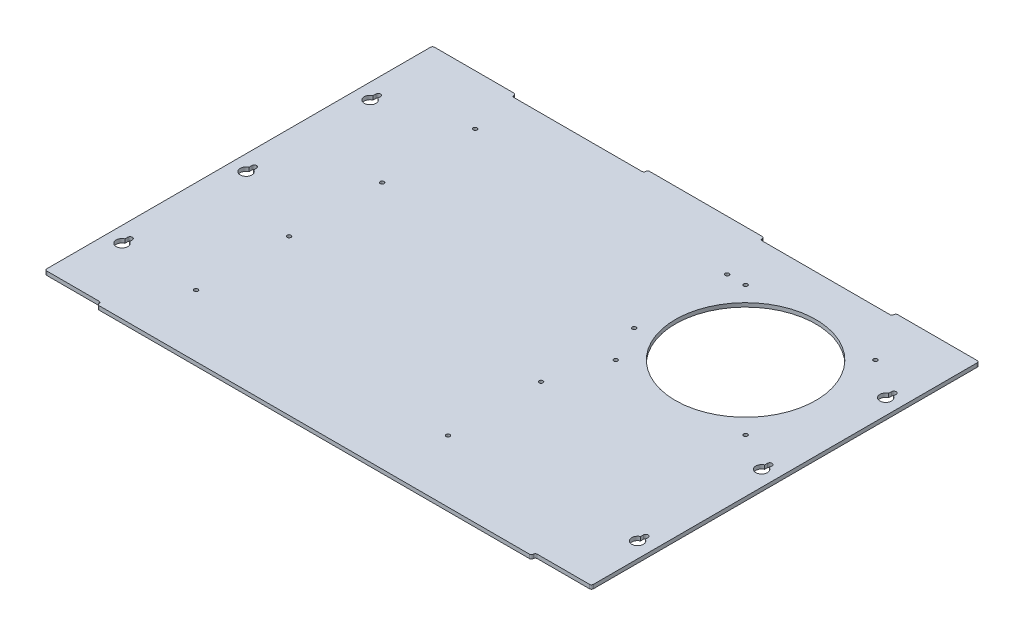
from build123d import *

# Parameters (mm, degrees)
BOSS_EXTRUDE1_DEPTH  = 3.175
SKETCH3_W            = 107.95
SKETCH3_H            = 3.175
CUT_EXTRUDE2_DEPTH   = 549.843544419
FILLET1_R            = 1.5875
CUT_EXTRUDE1_DEPTH   = 549.843544419
LPATTERN1_COUNT      = 3
LPATTERN1_PITCH      = 101.6
MIRROR1_COPY_1_DEPTH = 549.843544419
MIRROR1_COPY_2_DEPTH = 549.843544419
SKETCH4_R            = 1.5875
CUT_EXTRUDE3_DEPTH   = 549.843544419
LPATTERN2_COUNT      = 4
LPATTERN2_PITCH      = 76.2
SKETCH5_R            = 1.5875
SKETCH5_R_2          = 57.5
CUT_EXTRUDE4_DEPTH   = 549.843544419


with BuildPart() as part:
    # Sketch1 → Boss-Extrude1 (new body)
    with BuildSketch(Plane(origin=(0, 0, 0), x_dir=(1, 0, 0), z_dir=(0, 1, 0))):
        Polygon((401.6375, 0), (447.675, 0), (447.675, 317.5), (0, 317.5), (0, 0), (46.0375, 0), (46.0375, -3.175), (401.6375, -3.175), align=None)
    extrude(amount=BOSS_EXTRUDE1_DEPTH)

    # Sketch3 → Cut-Extrude2 (cut, through all)
    with BuildSketch(Plane(origin=(0, 3.175, 0), x_dir=(1, 0, 0), z_dir=(0, 1, 0))):
        with Locations((122.2375, 315.9125)):
            Rectangle(SKETCH3_W, SKETCH3_H)
        with Locations((325.4375, 315.9125)):
            Rectangle(SKETCH3_W, SKETCH3_H)
    extrude(amount=-CUT_EXTRUDE2_DEPTH, mode=Mode.SUBTRACT)

    # Fillet1
    fillet1_edges = [part.edges().sort_by_distance(p)[0] for p in [
        (379.4125, 1.5875, -317.5),
        (271.4625, 1.5875, -317.5),
        (176.2125, 1.5875, -317.5),
        (68.2625, 1.5875, -317.5),
        (379.4125, 1.5875, -314.325),
        (271.4625, 1.5875, -314.325),
        (176.2125, 1.5875, -314.325),
        (68.2625, 1.5875, -314.325),
        (447.675, 1.5875, -317.5),
        (447.675, 1.5875, 0),
        (0, 1.5875, 0),
        (0, 1.5875, -317.5),
        (401.6375, 1.5875, 3.175),
        (401.6375, 1.5875, 0),
        (46.0375, 1.5875, 3.175),
        (46.0375, 1.5875, 0),
    ]]
    fillet(fillet1_edges, radius=FILLET1_R - 0.0001)  # a hair under: the kernel refuses the full size

    # Sketch2 → Cut-Extrude1 (cut, through all)
    with BuildSketch(Plane(origin=(0, 3.175, 0), x_dir=(1, 0, 0), z_dir=(0, 1, 0))):
        with BuildLine():
            Line((10.795, 258.047403349), (10.795, 260.35))
            ThreePointArc((10.795, 260.35), (12.7, 262.255), (14.605, 260.35))
            Line((14.605, 260.35), (14.605, 258.047403349))
            ThreePointArc((14.605, 258.047403349), (12.7, 248.92), (10.795, 258.047403349))
        make_face()
    cut_extrude1 = extrude(amount=-CUT_EXTRUDE1_DEPTH, mode=Mode.SUBTRACT)

    # LPattern1: Cut-Extrude1 ×3
    with Locations(*[(0, 0, i * LPATTERN1_PITCH) for i in range(1, LPATTERN1_COUNT)]):
        add(cut_extrude1, mode=Mode.SUBTRACT)

    # Mirror1: Cut-Extrude1 across plane
    add(cut_extrude1.mirror(Plane.ZY.offset(-223.8375)), mode=Mode.SUBTRACT)

    # Mirror1 copy 1 sketch → Mirror1 copy 1 (cut, through all)
    with BuildSketch(Plane(origin=(447.675, 3.175, 101.6), x_dir=(-1, 0, 0), z_dir=(0, 1, 0))):
        with BuildLine():
            Line((10.795, -258.047403349), (10.795, -260.35))
            ThreePointArc((10.795, -260.35), (12.7, -262.255), (14.605, -260.35))
            Line((14.605, -260.35), (14.605, -258.047403349))
            ThreePointArc((14.605, -258.047403349), (12.7, -248.92), (10.795, -258.047403349))
        make_face()
    extrude(amount=-MIRROR1_COPY_1_DEPTH, mode=Mode.SUBTRACT)

    # Mirror1 copy 2 sketch → Mirror1 copy 2 (cut, through all)
    with BuildSketch(Plane(origin=(447.675, 3.175, 203.2), x_dir=(-1, 0, 0), z_dir=(0, 1, 0))):
        with BuildLine():
            Line((10.795, -258.047403349), (10.795, -260.35))
            ThreePointArc((10.795, -260.35), (12.7, -262.255), (14.605, -260.35))
            Line((14.605, -260.35), (14.605, -258.047403349))
            ThreePointArc((14.605, -258.047403349), (12.7, -248.92), (10.795, -258.047403349))
        make_face()
    extrude(amount=-MIRROR1_COPY_2_DEPTH, mode=Mode.SUBTRACT)

    # Sketch4 → Cut-Extrude3 (cut, through all)
    with BuildSketch(Plane(origin=(0, 3.175, 0), x_dir=(1, 0, 0), z_dir=(0, 1, 0))):
        with Locations(Location((282.575, 276.225, 0), (0, 0, 270))):
            Circle(SKETCH4_R)
        with Locations(Location((76.2, 276.225, 0), (0, 0, 270))):
            Circle(SKETCH4_R)
    cut_extrude3 = extrude(amount=-CUT_EXTRUDE3_DEPTH, mode=Mode.SUBTRACT)

    # LPattern2: Cut-Extrude3 ×4
    with Locations(*[(0, 0, i * LPATTERN2_PITCH) for i in range(1, LPATTERN2_COUNT)]):
        add(cut_extrude3, mode=Mode.SUBTRACT)

    # Sketch5 → Cut-Extrude4 (cut, through all)
    with BuildSketch(Plane(origin=(0, 3.175, 0), x_dir=(1, 0, 0), z_dir=(0, 1, 0))):
        with Locations(Location((297.65625, 276.225, 0), (0, 0, 270))):
            Circle(SKETCH5_R)
        with Locations(Location((404.01875, 276.225, 0), (0, 0, 270))):
            Circle(SKETCH5_R)
        with Locations(Location((404.01875, 169.8625, 0), (0, 0, 270))):
            Circle(SKETCH5_R)
        with Locations(Location((297.65625, 169.8625, 0), (0, 0, 270))):
            Circle(SKETCH5_R)
        with Locations(Location((350.8375, 223.04375, 0), (0, 0, 270))):
            Circle(SKETCH5_R_2)
    extrude(amount=-CUT_EXTRUDE4_DEPTH, mode=Mode.SUBTRACT)


solid = part.part
